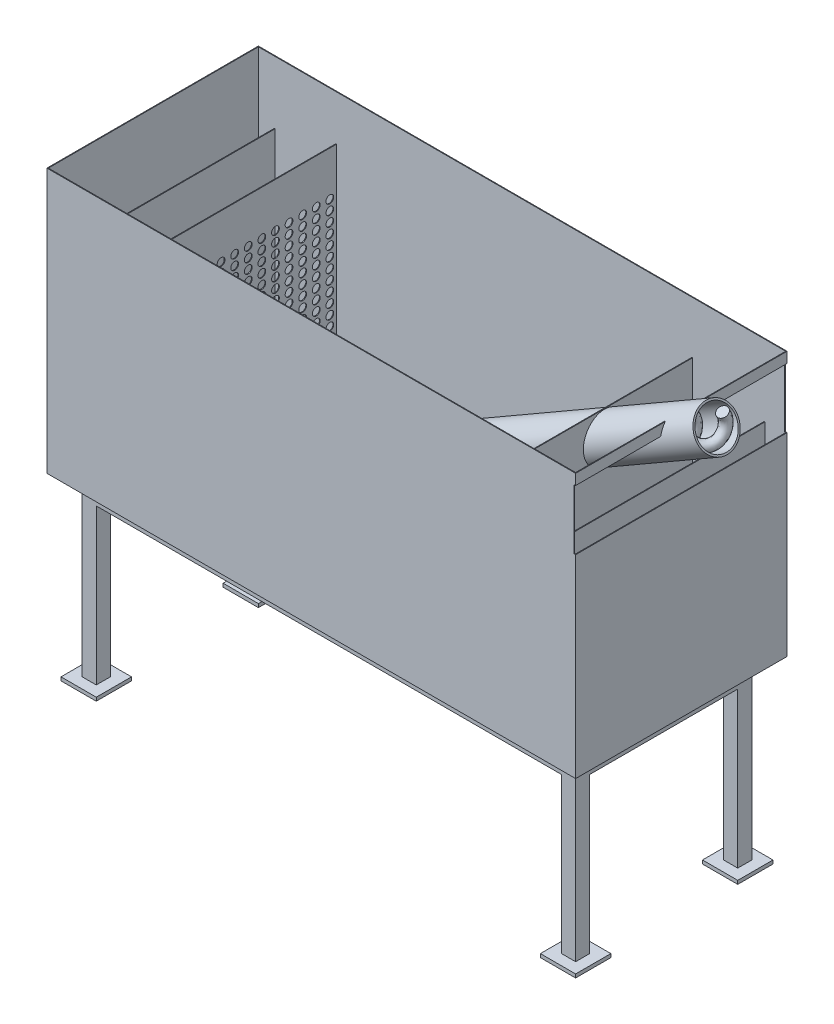
from build123d import *

# Parameters (mm, degrees)
MASTER_FOOTPRINT_W                       = 1500
MASTER_FOOTPRINT_H                       = 600
BATH_BASE_PLATE_DEPTH                    = 750
BATH_SHELL_2MM_T                         = -2
SKETCH_1_R                               = 50.00000000000001
INLET_D100_OPENING_DEPTH                 = 10
INLET_IMPACT_BAFFLE_START                = 125
SKETCH_2_W                               = 440
SKETCH_2_H                               = 430
INLET_IMPACT_BAFFLE_DEPTH                = 2
DISTRIBUTOR_D22_START                    = 250
SKETCH_3_W                               = 540
SKETCH_3_H                               = 648
SKETCH_3_R                               = 10.999999999999996
SKETCH_3_R_2                             = 11.00000000000001
SKETCH_3_R_3                             = 10.999999999999982
DISTRIBUTOR_D22_DEPTH                    = 2
OUTLET_SUBMERGED_BAFFLE_START            = 1280
SKETCH_4_W                               = 499.9999999999999
SKETCH_4_H                               = 330
OUTLET_SUBMERGED_BAFFLE_DEPTH            = 2
OVERFLOW_WEIR_Z550_START                 = 1440
SKETCH_5_W                               = 590
SKETCH_5_H                               = 548
OVERFLOW_WEIR_Z550_DEPTH                 = 2
OUTLET_WEIR_SLOT_W600_START              = 1495
SKETCH_6_W                               = 600
SKETCH_6_H                               = 170
OUTLET_WEIR_SLOT_W600_DEPTH              = 10
SLOPED_SEDIMENT_FLOOR_START              = 275
SLOPED_SEDIMENT_FLOOR_DEPTH              = 975
SKETCH_8_W                               = 39.99999999999999
SKETCH_8_H                               = 39.99999999999999
SKETCH_8_H_2                             = 39.99999999999994
SKETCH_8_W_2                             = 40
FRAME_LEGS_40X40_H500_DEPTH              = 500
FRAME_LONGITUDINAL_RAILS_START           = -20
SKETCH_9_W                               = 1400
SKETCH_9_H                               = 39.99999999999999
SKETCH_9_H_2                             = 39.99999999999983
FRAME_LONGITUDINAL_RAILS_DEPTH           = 40
FRAME_TRANSVERSE_RAILS_START             = -20
SKETCH_10_W                              = 39.99999999999999
SKETCH_10_H                              = 420.00000000000006
SKETCH_10_W_2                            = 40
FRAME_TRANSVERSE_RAILS_DEPTH             = 40
FRAME_FOOT_PADS_100X100_START            = -500
SKETCH_11_W                              = 100.00000000000001
SKETCH_11_H                              = 100.00000000000001
SKETCH_11_H_2                            = 99.99999999999994
SKETCH_11_W_2                            = 100
FRAME_FOOT_PADS_100X100_DEPTH            = 10
SCREW_PASSAGE_D120_PROFILE_R             = 60
SCREW_CASING_ID110_T5_PROFILE_R          = 60
SCREW_CASING_ID110_T5_PROFILE_R_2        = 55
SHAFTLESS_ROUND_COIL_D100_P100_PROFILE_R = 15


with BuildPart() as part:
    # MASTER_FOOTPRINT → BATH_BASE_PLATE (new body)
    with BuildSketch(Plane(origin=(0, 0, 0), x_dir=(1, 0, 0), z_dir=(0, 1, 0))):
        with Locations((750, 300)):
            Rectangle(MASTER_FOOTPRINT_W, MASTER_FOOTPRINT_H)
    extrude(amount=BATH_BASE_PLATE_DEPTH)

    # BATH_SHELL_2MM
    bath_shell_2mm_openings = [part.faces().sort_by_distance(p)[0] for p in [
        (750, 750, -300),
    ]]
    offset(amount=BATH_SHELL_2MM_T, openings=bath_shell_2mm_openings, kind=Kind.INTERSECTION)

    # Эскиз1 → INLET_D100_OPENING (cut)
    with BuildSketch(Plane(origin=(0, 0, 0), x_dir=(0, 0, -1), z_dir=(1, 0, 0))):
        with Locations((300, 420)):
            Circle(SKETCH_1_R)
    extrude(amount=INLET_D100_OPENING_DEPTH, mode=Mode.SUBTRACT)

    # Эскиз6 → OUTLET_WEIR_SLOT_W600 (cut)
    with BuildSketch(Plane(origin=(0, 0, 0), x_dir=(0, 0, -1), z_dir=(1, 0, 0)).offset(OUTLET_WEIR_SLOT_W600_START)):
        with Locations((300, 635)):
            Rectangle(SKETCH_6_W, SKETCH_6_H)
    extrude(amount=OUTLET_WEIR_SLOT_W600_DEPTH, mode=Mode.SUBTRACT)

    # Эскиз7 → SLOPED_SEDIMENT_FLOOR (add)
    with BuildSketch(Plane(origin=(0, 0, 0), x_dir=(0, 0, -1), z_dir=(1, 0, 0)).offset(SLOPED_SEDIMENT_FLOOR_START)):
        Polygon((2, -1), (2, 120), (229.99999999999997, -1), align=None)
        Polygon((598, -1), (598, 120), (370, -1), align=None)
    extrude(amount=SLOPED_SEDIMENT_FLOOR_DEPTH)

    # Эскиз8 → FRAME_LEGS_40X40_H500 (add)
    with BuildSketch(Plane(origin=(0, 0, 0), x_dir=(1, 0, 0), z_dir=(0, 1, 0))):
        with Locations((70, 70)):
            Rectangle(SKETCH_8_W, SKETCH_8_H)
        with Locations((70, 530)):
            Rectangle(SKETCH_8_W, SKETCH_8_H_2)
        with Locations((1430, 70)):
            Rectangle(SKETCH_8_W_2, SKETCH_8_H)
        with Locations((1430, 530)):
            Rectangle(SKETCH_8_W_2, SKETCH_8_H_2)
    extrude(amount=-FRAME_LEGS_40X40_H500_DEPTH)

    # Эскиз9 → FRAME_LONGITUDINAL_RAILS (add)
    with BuildSketch(Plane(origin=(0, 0, 0), x_dir=(1, 0, 0), z_dir=(0, 1, 0)).offset(FRAME_LONGITUDINAL_RAILS_START)):
        with Locations((750, 70)):
            Rectangle(SKETCH_9_W, SKETCH_9_H)
        with Locations((750, 530)):
            Rectangle(SKETCH_9_W, SKETCH_9_H_2)
    extrude(amount=-FRAME_LONGITUDINAL_RAILS_DEPTH)

    # Эскиз10 → FRAME_TRANSVERSE_RAILS (add)
    with BuildSketch(Plane(origin=(0, 0, 0), x_dir=(1, 0, 0), z_dir=(0, 1, 0)).offset(FRAME_TRANSVERSE_RAILS_START)):
        with Locations((70, 300)):
            Rectangle(SKETCH_10_W, SKETCH_10_H)
        with Locations((1430, 300)):
            Rectangle(SKETCH_10_W_2, SKETCH_10_H)
    extrude(amount=-FRAME_TRANSVERSE_RAILS_DEPTH)

    # Эскиз11 → FRAME_FOOT_PADS_100X100 (add)
    with BuildSketch(Plane(origin=(0, 0, 0), x_dir=(1, 0, 0), z_dir=(0, 1, 0)).offset(FRAME_FOOT_PADS_100X100_START)):
        with Locations((70, 70)):
            Rectangle(SKETCH_11_W, SKETCH_11_H)
        with Locations((70, 530)):
            Rectangle(SKETCH_11_W, SKETCH_11_H_2)
        with Locations((1430, 70)):
            Rectangle(SKETCH_11_W_2, SKETCH_11_H)
        with Locations((1430, 530)):
            Rectangle(SKETCH_11_W_2, SKETCH_11_H_2)
    extrude(amount=-FRAME_FOOT_PADS_100X100_DEPTH)


with BuildPart() as body_2:
    # Эскиз2 → INLET_IMPACT_BAFFLE (new body)
    with BuildSketch(Plane(origin=(0, 0, 0), x_dir=(0, 0, -1), z_dir=(1, 0, 0)).offset(INLET_IMPACT_BAFFLE_START)):
        with Locations((300, 435)):
            Rectangle(SKETCH_2_W, SKETCH_2_H)
    extrude(amount=INLET_IMPACT_BAFFLE_DEPTH)


with BuildPart() as body_3:
    # Эскиз3 → DISTRIBUTOR_D22 (new body)
    with BuildSketch(Plane(origin=(0, 0, 0), x_dir=(0, 0, -1), z_dir=(1, 0, 0)).offset(DISTRIBUTOR_D22_START)):
        with Locations((300, 326)):
            Rectangle(SKETCH_3_W, SKETCH_3_H)
        with Locations((49.28571428571428, 125)):
            Circle(SKETCH_3_R, mode=Mode.SUBTRACT)
        with Locations((49.28571428571428, 153.5)):
            Circle(SKETCH_3_R, mode=Mode.SUBTRACT)
        with Locations((49.28571428571428, 182)):
            Circle(SKETCH_3_R, mode=Mode.SUBTRACT)
        with Locations((49.28571428571428, 210.50000000000003)):
            Circle(SKETCH_3_R, mode=Mode.SUBTRACT)
        with Locations((49.28571428571428, 239)):
            Circle(SKETCH_3_R, mode=Mode.SUBTRACT)
        with Locations((49.28571428571428, 267.5)):
            Circle(SKETCH_3_R, mode=Mode.SUBTRACT)
        with Locations((49.28571428571428, 296.00000000000006)):
            Circle(SKETCH_3_R, mode=Mode.SUBTRACT)
        with Locations((49.28571428571428, 324.5)):
            Circle(SKETCH_3_R, mode=Mode.SUBTRACT)
        with Locations((49.28571428571428, 353)):
            Circle(SKETCH_3_R, mode=Mode.SUBTRACT)
        with Locations((49.28571428571428, 381.5)):
            Circle(SKETCH_3_R, mode=Mode.SUBTRACT)
        with Locations((49.28571428571428, 410.00000000000006)):
            Circle(SKETCH_3_R, mode=Mode.SUBTRACT)
        with Locations((49.28571428571428, 438.5)):
            Circle(SKETCH_3_R, mode=Mode.SUBTRACT)
        with Locations((49.28571428571428, 467)):
            Circle(SKETCH_3_R, mode=Mode.SUBTRACT)
        with Locations((49.28571428571428, 495.5)):
            Circle(SKETCH_3_R, mode=Mode.SUBTRACT)
        with Locations((49.28571428571428, 524)):
            Circle(SKETCH_3_R, mode=Mode.SUBTRACT)
        with Locations((87.85714285714285, 125)):
            Circle(SKETCH_3_R, mode=Mode.SUBTRACT)
        with Locations((87.85714285714285, 153.5)):
            Circle(SKETCH_3_R, mode=Mode.SUBTRACT)
        with Locations((87.85714285714285, 182)):
            Circle(SKETCH_3_R, mode=Mode.SUBTRACT)
        with Locations((87.85714285714285, 210.50000000000003)):
            Circle(SKETCH_3_R, mode=Mode.SUBTRACT)
        with Locations((87.85714285714285, 239)):
            Circle(SKETCH_3_R, mode=Mode.SUBTRACT)
        with Locations((87.85714285714285, 267.5)):
            Circle(SKETCH_3_R, mode=Mode.SUBTRACT)
        with Locations((87.85714285714285, 296.00000000000006)):
            Circle(SKETCH_3_R, mode=Mode.SUBTRACT)
        with Locations((87.85714285714285, 324.5)):
            Circle(SKETCH_3_R, mode=Mode.SUBTRACT)
        with Locations((87.85714285714285, 353)):
            Circle(SKETCH_3_R, mode=Mode.SUBTRACT)
        with Locations((87.85714285714285, 381.5)):
            Circle(SKETCH_3_R, mode=Mode.SUBTRACT)
        with Locations((87.85714285714285, 410.00000000000006)):
            Circle(SKETCH_3_R, mode=Mode.SUBTRACT)
        with Locations((87.85714285714285, 438.5)):
            Circle(SKETCH_3_R, mode=Mode.SUBTRACT)
        with Locations((87.85714285714285, 467)):
            Circle(SKETCH_3_R, mode=Mode.SUBTRACT)
        with Locations((87.85714285714285, 495.5)):
            Circle(SKETCH_3_R, mode=Mode.SUBTRACT)
        with Locations((87.85714285714285, 524)):
            Circle(SKETCH_3_R, mode=Mode.SUBTRACT)
        with Locations((126.42857142857142, 125)):
            Circle(SKETCH_3_R_2, mode=Mode.SUBTRACT)
        with Locations((126.42857142857142, 153.5)):
            Circle(SKETCH_3_R_2, mode=Mode.SUBTRACT)
        with Locations((126.42857142857142, 182)):
            Circle(SKETCH_3_R_2, mode=Mode.SUBTRACT)
        with Locations((126.42857142857142, 210.50000000000003)):
            Circle(SKETCH_3_R_2, mode=Mode.SUBTRACT)
        with Locations((126.42857142857142, 239)):
            Circle(SKETCH_3_R_2, mode=Mode.SUBTRACT)
        with Locations((126.42857142857142, 267.5)):
            Circle(SKETCH_3_R_2, mode=Mode.SUBTRACT)
        with Locations((126.42857142857142, 296.00000000000006)):
            Circle(SKETCH_3_R_2, mode=Mode.SUBTRACT)
        with Locations((126.42857142857142, 324.5)):
            Circle(SKETCH_3_R_2, mode=Mode.SUBTRACT)
        with Locations((126.42857142857142, 353)):
            Circle(SKETCH_3_R_2, mode=Mode.SUBTRACT)
        with Locations((126.42857142857142, 381.5)):
            Circle(SKETCH_3_R_2, mode=Mode.SUBTRACT)
        with Locations((126.42857142857142, 410.00000000000006)):
            Circle(SKETCH_3_R_2, mode=Mode.SUBTRACT)
        with Locations((126.42857142857142, 438.5)):
            Circle(SKETCH_3_R_2, mode=Mode.SUBTRACT)
        with Locations((126.42857142857142, 467)):
            Circle(SKETCH_3_R_2, mode=Mode.SUBTRACT)
        with Locations((126.42857142857142, 495.5)):
            Circle(SKETCH_3_R_2, mode=Mode.SUBTRACT)
        with Locations((126.42857142857142, 524)):
            Circle(SKETCH_3_R_2, mode=Mode.SUBTRACT)
        with Locations((164.99999999999997, 125)):
            Circle(SKETCH_3_R_2, mode=Mode.SUBTRACT)
        with Locations((164.99999999999997, 153.5)):
            Circle(SKETCH_3_R_2, mode=Mode.SUBTRACT)
        with Locations((164.99999999999997, 182)):
            Circle(SKETCH_3_R_2, mode=Mode.SUBTRACT)
        with Locations((164.99999999999997, 210.50000000000003)):
            Circle(SKETCH_3_R_2, mode=Mode.SUBTRACT)
        with Locations((164.99999999999997, 239)):
            Circle(SKETCH_3_R_2, mode=Mode.SUBTRACT)
        with Locations((164.99999999999997, 267.5)):
            Circle(SKETCH_3_R_2, mode=Mode.SUBTRACT)
        with Locations((164.99999999999997, 296.00000000000006)):
            Circle(SKETCH_3_R_2, mode=Mode.SUBTRACT)
        with Locations((164.99999999999997, 324.5)):
            Circle(SKETCH_3_R_2, mode=Mode.SUBTRACT)
        with Locations((164.99999999999997, 353)):
            Circle(SKETCH_3_R_2, mode=Mode.SUBTRACT)
        with Locations((164.99999999999997, 381.5)):
            Circle(SKETCH_3_R_2, mode=Mode.SUBTRACT)
        with Locations((164.99999999999997, 410.00000000000006)):
            Circle(SKETCH_3_R_2, mode=Mode.SUBTRACT)
        with Locations((164.99999999999997, 438.5)):
            Circle(SKETCH_3_R_2, mode=Mode.SUBTRACT)
        with Locations((164.99999999999997, 467)):
            Circle(SKETCH_3_R_2, mode=Mode.SUBTRACT)
        with Locations((164.99999999999997, 495.5)):
            Circle(SKETCH_3_R_2, mode=Mode.SUBTRACT)
        with Locations((164.99999999999997, 524)):
            Circle(SKETCH_3_R_2, mode=Mode.SUBTRACT)
        with Locations((203.57142857142856, 125)):
            Circle(SKETCH_3_R_2, mode=Mode.SUBTRACT)
        with Locations((203.57142857142856, 153.5)):
            Circle(SKETCH_3_R_2, mode=Mode.SUBTRACT)
        with Locations((203.57142857142856, 182)):
            Circle(SKETCH_3_R_2, mode=Mode.SUBTRACT)
        with Locations((203.57142857142856, 210.50000000000003)):
            Circle(SKETCH_3_R_2, mode=Mode.SUBTRACT)
        with Locations((203.57142857142856, 239)):
            Circle(SKETCH_3_R_2, mode=Mode.SUBTRACT)
        with Locations((203.57142857142856, 267.5)):
            Circle(SKETCH_3_R_2, mode=Mode.SUBTRACT)
        with Locations((203.57142857142856, 296.00000000000006)):
            Circle(SKETCH_3_R_2, mode=Mode.SUBTRACT)
        with Locations((203.57142857142856, 324.5)):
            Circle(SKETCH_3_R_2, mode=Mode.SUBTRACT)
        with Locations((203.57142857142856, 353)):
            Circle(SKETCH_3_R_2, mode=Mode.SUBTRACT)
        with Locations((203.57142857142856, 381.5)):
            Circle(SKETCH_3_R_2, mode=Mode.SUBTRACT)
        with Locations((203.57142857142856, 410.00000000000006)):
            Circle(SKETCH_3_R_2, mode=Mode.SUBTRACT)
        with Locations((203.57142857142856, 438.5)):
            Circle(SKETCH_3_R_2, mode=Mode.SUBTRACT)
        with Locations((203.57142857142856, 467)):
            Circle(SKETCH_3_R_2, mode=Mode.SUBTRACT)
        with Locations((203.57142857142856, 495.5)):
            Circle(SKETCH_3_R_2, mode=Mode.SUBTRACT)
        with Locations((203.57142857142856, 524)):
            Circle(SKETCH_3_R_2, mode=Mode.SUBTRACT)
        with Locations((242.14285714285714, 125)):
            Circle(SKETCH_3_R_3, mode=Mode.SUBTRACT)
        with Locations((242.14285714285714, 153.5)):
            Circle(SKETCH_3_R_3, mode=Mode.SUBTRACT)
        with Locations((242.14285714285714, 182)):
            Circle(SKETCH_3_R_3, mode=Mode.SUBTRACT)
        with Locations((242.14285714285714, 210.50000000000003)):
            Circle(SKETCH_3_R_3, mode=Mode.SUBTRACT)
        with Locations((242.14285714285714, 239)):
            Circle(SKETCH_3_R_3, mode=Mode.SUBTRACT)
        with Locations((242.14285714285714, 267.5)):
            Circle(SKETCH_3_R_3, mode=Mode.SUBTRACT)
        with Locations((242.14285714285714, 296.00000000000006)):
            Circle(SKETCH_3_R_3, mode=Mode.SUBTRACT)
        with Locations((242.14285714285714, 324.5)):
            Circle(SKETCH_3_R_3, mode=Mode.SUBTRACT)
        with Locations((242.14285714285714, 353)):
            Circle(SKETCH_3_R_3, mode=Mode.SUBTRACT)
        with Locations((242.14285714285714, 381.5)):
            Circle(SKETCH_3_R_3, mode=Mode.SUBTRACT)
        with Locations((242.14285714285714, 410.00000000000006)):
            Circle(SKETCH_3_R_3, mode=Mode.SUBTRACT)
        with Locations((242.14285714285714, 438.5)):
            Circle(SKETCH_3_R_3, mode=Mode.SUBTRACT)
        with Locations((242.14285714285714, 467)):
            Circle(SKETCH_3_R_3, mode=Mode.SUBTRACT)
        with Locations((242.14285714285714, 495.5)):
            Circle(SKETCH_3_R_3, mode=Mode.SUBTRACT)
        with Locations((242.14285714285714, 524)):
            Circle(SKETCH_3_R_3, mode=Mode.SUBTRACT)
        with Locations((280.71428571428567, 125)):
            Circle(SKETCH_3_R_2, mode=Mode.SUBTRACT)
        with Locations((280.71428571428567, 153.5)):
            Circle(SKETCH_3_R_2, mode=Mode.SUBTRACT)
        with Locations((280.71428571428567, 182)):
            Circle(SKETCH_3_R_2, mode=Mode.SUBTRACT)
        with Locations((280.71428571428567, 210.50000000000003)):
            Circle(SKETCH_3_R_2, mode=Mode.SUBTRACT)
        with Locations((280.71428571428567, 239)):
            Circle(SKETCH_3_R_2, mode=Mode.SUBTRACT)
        with Locations((280.71428571428567, 267.5)):
            Circle(SKETCH_3_R_2, mode=Mode.SUBTRACT)
        with Locations((280.71428571428567, 296.00000000000006)):
            Circle(SKETCH_3_R_2, mode=Mode.SUBTRACT)
        with Locations((280.71428571428567, 324.5)):
            Circle(SKETCH_3_R_2, mode=Mode.SUBTRACT)
        with Locations((280.71428571428567, 353)):
            Circle(SKETCH_3_R_2, mode=Mode.SUBTRACT)
        with Locations((280.71428571428567, 381.5)):
            Circle(SKETCH_3_R_2, mode=Mode.SUBTRACT)
        with Locations((280.71428571428567, 410.00000000000006)):
            Circle(SKETCH_3_R_2, mode=Mode.SUBTRACT)
        with Locations((280.71428571428567, 438.5)):
            Circle(SKETCH_3_R_2, mode=Mode.SUBTRACT)
        with Locations((280.71428571428567, 467)):
            Circle(SKETCH_3_R_2, mode=Mode.SUBTRACT)
        with Locations((280.71428571428567, 495.5)):
            Circle(SKETCH_3_R_2, mode=Mode.SUBTRACT)
        with Locations((280.71428571428567, 524)):
            Circle(SKETCH_3_R_2, mode=Mode.SUBTRACT)
        with Locations((319.2857142857143, 125)):
            Circle(SKETCH_3_R_2, mode=Mode.SUBTRACT)
        with Locations((319.2857142857143, 153.5)):
            Circle(SKETCH_3_R_2, mode=Mode.SUBTRACT)
        with Locations((319.2857142857143, 182)):
            Circle(SKETCH_3_R_2, mode=Mode.SUBTRACT)
        with Locations((319.2857142857143, 210.50000000000003)):
            Circle(SKETCH_3_R_2, mode=Mode.SUBTRACT)
        with Locations((319.2857142857143, 239)):
            Circle(SKETCH_3_R_2, mode=Mode.SUBTRACT)
        with Locations((319.2857142857143, 267.5)):
            Circle(SKETCH_3_R_2, mode=Mode.SUBTRACT)
        with Locations((319.2857142857143, 296.00000000000006)):
            Circle(SKETCH_3_R_2, mode=Mode.SUBTRACT)
        with Locations((319.2857142857143, 324.5)):
            Circle(SKETCH_3_R_2, mode=Mode.SUBTRACT)
        with Locations((319.2857142857143, 353)):
            Circle(SKETCH_3_R_2, mode=Mode.SUBTRACT)
        with Locations((319.2857142857143, 381.5)):
            Circle(SKETCH_3_R_2, mode=Mode.SUBTRACT)
        with Locations((319.2857142857143, 410.00000000000006)):
            Circle(SKETCH_3_R_2, mode=Mode.SUBTRACT)
        with Locations((319.2857142857143, 438.5)):
            Circle(SKETCH_3_R_2, mode=Mode.SUBTRACT)
        with Locations((319.2857142857143, 467)):
            Circle(SKETCH_3_R_2, mode=Mode.SUBTRACT)
        with Locations((319.2857142857143, 495.5)):
            Circle(SKETCH_3_R_2, mode=Mode.SUBTRACT)
        with Locations((319.2857142857143, 524)):
            Circle(SKETCH_3_R_2, mode=Mode.SUBTRACT)
        with Locations((357.8571428571428, 125)):
            Circle(SKETCH_3_R_2, mode=Mode.SUBTRACT)
        with Locations((357.8571428571428, 153.5)):
            Circle(SKETCH_3_R_2, mode=Mode.SUBTRACT)
        with Locations((357.8571428571428, 182)):
            Circle(SKETCH_3_R_2, mode=Mode.SUBTRACT)
        with Locations((357.8571428571428, 210.50000000000003)):
            Circle(SKETCH_3_R_2, mode=Mode.SUBTRACT)
        with Locations((357.8571428571428, 239)):
            Circle(SKETCH_3_R_2, mode=Mode.SUBTRACT)
        with Locations((357.8571428571428, 267.5)):
            Circle(SKETCH_3_R_2, mode=Mode.SUBTRACT)
        with Locations((357.8571428571428, 296.00000000000006)):
            Circle(SKETCH_3_R_2, mode=Mode.SUBTRACT)
        with Locations((357.8571428571428, 324.5)):
            Circle(SKETCH_3_R_2, mode=Mode.SUBTRACT)
        with Locations((357.8571428571428, 353)):
            Circle(SKETCH_3_R_2, mode=Mode.SUBTRACT)
        with Locations((357.8571428571428, 381.5)):
            Circle(SKETCH_3_R_2, mode=Mode.SUBTRACT)
        with Locations((357.8571428571428, 410.00000000000006)):
            Circle(SKETCH_3_R_2, mode=Mode.SUBTRACT)
        with Locations((357.8571428571428, 438.5)):
            Circle(SKETCH_3_R_2, mode=Mode.SUBTRACT)
        with Locations((357.8571428571428, 467)):
            Circle(SKETCH_3_R_2, mode=Mode.SUBTRACT)
        with Locations((357.8571428571428, 495.5)):
            Circle(SKETCH_3_R_2, mode=Mode.SUBTRACT)
        with Locations((357.8571428571428, 524)):
            Circle(SKETCH_3_R_2, mode=Mode.SUBTRACT)
        with Locations((396.42857142857133, 125)):
            Circle(SKETCH_3_R_2, mode=Mode.SUBTRACT)
        with Locations((396.42857142857133, 153.5)):
            Circle(SKETCH_3_R_2, mode=Mode.SUBTRACT)
        with Locations((396.42857142857133, 182)):
            Circle(SKETCH_3_R_2, mode=Mode.SUBTRACT)
        with Locations((396.42857142857133, 210.50000000000003)):
            Circle(SKETCH_3_R_2, mode=Mode.SUBTRACT)
        with Locations((396.42857142857133, 239)):
            Circle(SKETCH_3_R_2, mode=Mode.SUBTRACT)
        with Locations((396.42857142857133, 267.5)):
            Circle(SKETCH_3_R_2, mode=Mode.SUBTRACT)
        with Locations((396.42857142857133, 296.00000000000006)):
            Circle(SKETCH_3_R_2, mode=Mode.SUBTRACT)
        with Locations((396.42857142857133, 324.5)):
            Circle(SKETCH_3_R_2, mode=Mode.SUBTRACT)
        with Locations((396.42857142857133, 353)):
            Circle(SKETCH_3_R_2, mode=Mode.SUBTRACT)
        with Locations((396.42857142857133, 381.5)):
            Circle(SKETCH_3_R_2, mode=Mode.SUBTRACT)
        with Locations((396.42857142857133, 410.00000000000006)):
            Circle(SKETCH_3_R_2, mode=Mode.SUBTRACT)
        with Locations((396.42857142857133, 438.5)):
            Circle(SKETCH_3_R_2, mode=Mode.SUBTRACT)
        with Locations((396.42857142857133, 467)):
            Circle(SKETCH_3_R_2, mode=Mode.SUBTRACT)
        with Locations((396.42857142857133, 495.5)):
            Circle(SKETCH_3_R_2, mode=Mode.SUBTRACT)
        with Locations((396.42857142857133, 524)):
            Circle(SKETCH_3_R_2, mode=Mode.SUBTRACT)
        with Locations((434.99999999999994, 125)):
            Circle(SKETCH_3_R_2, mode=Mode.SUBTRACT)
        with Locations((434.99999999999994, 153.5)):
            Circle(SKETCH_3_R_2, mode=Mode.SUBTRACT)
        with Locations((434.99999999999994, 182)):
            Circle(SKETCH_3_R_2, mode=Mode.SUBTRACT)
        with Locations((434.99999999999994, 210.50000000000003)):
            Circle(SKETCH_3_R_2, mode=Mode.SUBTRACT)
        with Locations((434.99999999999994, 239)):
            Circle(SKETCH_3_R_2, mode=Mode.SUBTRACT)
        with Locations((434.99999999999994, 267.5)):
            Circle(SKETCH_3_R_2, mode=Mode.SUBTRACT)
        with Locations((434.99999999999994, 296.00000000000006)):
            Circle(SKETCH_3_R_2, mode=Mode.SUBTRACT)
        with Locations((434.99999999999994, 324.5)):
            Circle(SKETCH_3_R_2, mode=Mode.SUBTRACT)
        with Locations((434.99999999999994, 353)):
            Circle(SKETCH_3_R_2, mode=Mode.SUBTRACT)
        with Locations((434.99999999999994, 381.5)):
            Circle(SKETCH_3_R_2, mode=Mode.SUBTRACT)
        with Locations((434.99999999999994, 410.00000000000006)):
            Circle(SKETCH_3_R_2, mode=Mode.SUBTRACT)
        with Locations((434.99999999999994, 438.5)):
            Circle(SKETCH_3_R_2, mode=Mode.SUBTRACT)
        with Locations((434.99999999999994, 467)):
            Circle(SKETCH_3_R_2, mode=Mode.SUBTRACT)
        with Locations((434.99999999999994, 495.5)):
            Circle(SKETCH_3_R_2, mode=Mode.SUBTRACT)
        with Locations((434.99999999999994, 524)):
            Circle(SKETCH_3_R_2, mode=Mode.SUBTRACT)
        with Locations((473.57142857142856, 125)):
            Circle(SKETCH_3_R_2, mode=Mode.SUBTRACT)
        with Locations((473.57142857142856, 153.5)):
            Circle(SKETCH_3_R_2, mode=Mode.SUBTRACT)
        with Locations((473.57142857142856, 182)):
            Circle(SKETCH_3_R_2, mode=Mode.SUBTRACT)
        with Locations((473.57142857142856, 210.50000000000003)):
            Circle(SKETCH_3_R_2, mode=Mode.SUBTRACT)
        with Locations((473.57142857142856, 239)):
            Circle(SKETCH_3_R_2, mode=Mode.SUBTRACT)
        with Locations((473.57142857142856, 267.5)):
            Circle(SKETCH_3_R_2, mode=Mode.SUBTRACT)
        with Locations((473.57142857142856, 296.00000000000006)):
            Circle(SKETCH_3_R_2, mode=Mode.SUBTRACT)
        with Locations((473.57142857142856, 324.5)):
            Circle(SKETCH_3_R_2, mode=Mode.SUBTRACT)
        with Locations((473.57142857142856, 353)):
            Circle(SKETCH_3_R_2, mode=Mode.SUBTRACT)
        with Locations((473.57142857142856, 381.5)):
            Circle(SKETCH_3_R_2, mode=Mode.SUBTRACT)
        with Locations((473.57142857142856, 410.00000000000006)):
            Circle(SKETCH_3_R_2, mode=Mode.SUBTRACT)
        with Locations((473.57142857142856, 438.5)):
            Circle(SKETCH_3_R_2, mode=Mode.SUBTRACT)
        with Locations((473.57142857142856, 467)):
            Circle(SKETCH_3_R_2, mode=Mode.SUBTRACT)
        with Locations((473.57142857142856, 495.5)):
            Circle(SKETCH_3_R_2, mode=Mode.SUBTRACT)
        with Locations((473.57142857142856, 524)):
            Circle(SKETCH_3_R_2, mode=Mode.SUBTRACT)
        with Locations((512.1428571428571, 125)):
            Circle(SKETCH_3_R_2, mode=Mode.SUBTRACT)
        with Locations((512.1428571428571, 153.5)):
            Circle(SKETCH_3_R_2, mode=Mode.SUBTRACT)
        with Locations((512.1428571428571, 182)):
            Circle(SKETCH_3_R_2, mode=Mode.SUBTRACT)
        with Locations((512.1428571428571, 210.50000000000003)):
            Circle(SKETCH_3_R_2, mode=Mode.SUBTRACT)
        with Locations((512.1428571428571, 239)):
            Circle(SKETCH_3_R_2, mode=Mode.SUBTRACT)
        with Locations((512.1428571428571, 267.5)):
            Circle(SKETCH_3_R_2, mode=Mode.SUBTRACT)
        with Locations((512.1428571428571, 296.00000000000006)):
            Circle(SKETCH_3_R_2, mode=Mode.SUBTRACT)
        with Locations((512.1428571428571, 324.5)):
            Circle(SKETCH_3_R_2, mode=Mode.SUBTRACT)
        with Locations((512.1428571428571, 353)):
            Circle(SKETCH_3_R_2, mode=Mode.SUBTRACT)
        with Locations((512.1428571428571, 381.5)):
            Circle(SKETCH_3_R_2, mode=Mode.SUBTRACT)
        with Locations((512.1428571428571, 410.00000000000006)):
            Circle(SKETCH_3_R_2, mode=Mode.SUBTRACT)
        with Locations((512.1428571428571, 438.5)):
            Circle(SKETCH_3_R_2, mode=Mode.SUBTRACT)
        with Locations((512.1428571428571, 467)):
            Circle(SKETCH_3_R_2, mode=Mode.SUBTRACT)
        with Locations((512.1428571428571, 495.5)):
            Circle(SKETCH_3_R_2, mode=Mode.SUBTRACT)
        with Locations((512.1428571428571, 524)):
            Circle(SKETCH_3_R_2, mode=Mode.SUBTRACT)
        with Locations((550.7142857142857, 125)):
            Circle(SKETCH_3_R_2, mode=Mode.SUBTRACT)
        with Locations((550.7142857142857, 153.5)):
            Circle(SKETCH_3_R_2, mode=Mode.SUBTRACT)
        with Locations((550.7142857142857, 182)):
            Circle(SKETCH_3_R_2, mode=Mode.SUBTRACT)
        with Locations((550.7142857142857, 210.50000000000003)):
            Circle(SKETCH_3_R_2, mode=Mode.SUBTRACT)
        with Locations((550.7142857142857, 239)):
            Circle(SKETCH_3_R_2, mode=Mode.SUBTRACT)
        with Locations((550.7142857142857, 267.5)):
            Circle(SKETCH_3_R_2, mode=Mode.SUBTRACT)
        with Locations((550.7142857142857, 296.00000000000006)):
            Circle(SKETCH_3_R_2, mode=Mode.SUBTRACT)
        with Locations((550.7142857142857, 324.5)):
            Circle(SKETCH_3_R_2, mode=Mode.SUBTRACT)
        with Locations((550.7142857142857, 353)):
            Circle(SKETCH_3_R_2, mode=Mode.SUBTRACT)
        with Locations((550.7142857142857, 381.5)):
            Circle(SKETCH_3_R_2, mode=Mode.SUBTRACT)
        with Locations((550.7142857142857, 410.00000000000006)):
            Circle(SKETCH_3_R_2, mode=Mode.SUBTRACT)
        with Locations((550.7142857142857, 438.5)):
            Circle(SKETCH_3_R_2, mode=Mode.SUBTRACT)
        with Locations((550.7142857142857, 467)):
            Circle(SKETCH_3_R_2, mode=Mode.SUBTRACT)
        with Locations((550.7142857142857, 495.5)):
            Circle(SKETCH_3_R_2, mode=Mode.SUBTRACT)
        with Locations((550.7142857142857, 524)):
            Circle(SKETCH_3_R_2, mode=Mode.SUBTRACT)
    extrude(amount=DISTRIBUTOR_D22_DEPTH)


with BuildPart() as body_4:
    # Эскиз4 → OUTLET_SUBMERGED_BAFFLE (new body)
    with BuildSketch(Plane(origin=(0, 0, 0), x_dir=(0, 0, -1), z_dir=(1, 0, 0)).offset(OUTLET_SUBMERGED_BAFFLE_START)):
        with Locations((299.99999999999994, 485)):
            Rectangle(SKETCH_4_W, SKETCH_4_H)
    extrude(amount=OUTLET_SUBMERGED_BAFFLE_DEPTH)


with BuildPart() as body_5:
    # Эскиз5 → OVERFLOW_WEIR_Z550 (new body)
    with BuildSketch(Plane(origin=(0, 0, 0), x_dir=(0, 0, -1), z_dir=(1, 0, 0)).offset(OVERFLOW_WEIR_Z550_START)):
        with Locations((300, 276)):
            Rectangle(SKETCH_5_W, SKETCH_5_H)
    extrude(amount=OVERFLOW_WEIR_Z550_DEPTH)


with BuildPart() as screw_passage_d120_tool:
    # SCREW_PASSAGE_D120: sweep along a curve in space
    with BuildLine() as screw_passage_d120_path:
        Line((400, 70, -300), (1600, 762.820323027551, -300))
    # SCREW_PASSAGE_D120 profile (on start of the path) → SCREW_PASSAGE_D120 (sweep)
    with BuildSketch(Plane(origin=(400, 70, -300), x_dir=(-0.5000000000000001, 0.8660254037844387, 0), z_dir=(0.8660254037844387, 0.5000000000000001, 0))):
        Circle(SCREW_PASSAGE_D120_PROFILE_R)
    sweep(path=screw_passage_d120_path.line)


with BuildPart() as part_1:
    add(part.part)

    # SCREW_PASSAGE_D120: cut by screw_passage_d120_tool
    add(screw_passage_d120_tool.part, mode=Mode.SUBTRACT)


with BuildPart() as body_4_1:
    add(body_4.part)

    # SCREW_PASSAGE_D120: cut by screw_passage_d120_tool
    add(screw_passage_d120_tool.part, mode=Mode.SUBTRACT)


with BuildPart() as body_6:
    # SCREW_CASING_ID110_T5: sweep along a curve in space
    with BuildLine() as screw_casing_id110_t5_path:
        Line((400, 70, -300), (1600, 762.820323027551, -300))
    # SCREW_CASING_ID110_T5 profile (on start of the path) → SCREW_CASING_ID110_T5 (sweep)
    with BuildSketch(Plane(origin=(400, 70, -300), x_dir=(-0.5000000000000001, 0.8660254037844387, 0), z_dir=(0.8660254037844387, 0.5000000000000001, 0))):
        Circle(SCREW_CASING_ID110_T5_PROFILE_R)
        Circle(SCREW_CASING_ID110_T5_PROFILE_R_2, mode=Mode.SUBTRACT)
    sweep(path=screw_casing_id110_t5_path.line)


with BuildPart() as body_7:
    # SHAFTLESS_ROUND_COIL_D100_P100: sweep along a curve in space
    with BuildLine() as shaftless_round_coil_d100_p100_path:
        add(Edge.make_bspline(
            [(382.5, 100.31088913245537, -300), (384.564126832484, 100.89679960651334, -295.4252626190951), (388.6923804974521, 102.06862055462925, -286.2757878572854), (398.13442746402075, 98.19776454464007, -274.63543839458805), (409.3104600517273, 91.32355733924642, -266.8464038762299), (421.58617012040133, 82.54465286487766, -264.09135899256023), (433.85356596039986, 73.78014905700061, -266.78862540424325), (445.0881010529496, 66.80461254084834, -274.5286544424799), (454.4000360154246, 63.1591171326243, -286.13621233156675), (461.197456487716, 63.86888857776613, -299.8488258278908), (465.26866699277394, 69.30059419825714, -313.5843933715703), (466.8163390998659, 79.10319653887622, -325.25732809645314), (466.426200947709, 92.26218470394231, -333.09523004350996), (464.9782451375268, 107.25336679785208, -335.9080045692546), (463.5130734819898, 122.2743676106112, -333.2685644354147), (463.0739040042549, 135.5182805227412, -325.57767806015863), (464.54816759331237, 145.44803014630403, -314.003117474915), (468.5327626423438, 151.02975813735404, -300.302345664835), (475.2434227413281, 151.88980295714714, -286.55566616687736), (484.4819600829853, 148.37143595733454, -274.85035306876887), (495.6663579719135, 141.48273962520364, -266.96372261055393), (507.91914332354327, 132.7435419255055, -264.09326829583546), (520.2006207893836, 123.95464802621649, -266.6748353708781), (531.4667384557318, 116.92440888761196, -274.3164427712902), (540.8276150360007, 113.19414411076411, -285.85780090729605), (547.6826580387994, 113.80411040540636, -299.5464882011584), (551.8117567825574, 119.13555065530883, -313.30403600976126), (553.4087036535182, 128.85280660137536, -325.04152001826714), (553.0517689761136, 141.95428466118315, -332.9767392064443), (551.61589736088, 156.92453631547306, -335.9048224347294), (550.1398574976865, 171.9643614160809, -333.38117417370665), (549.6685171596843, 185.26399589271685, -325.7889811865904), (551.0941921320922, 195.27790346898624, -314.281030056743), (555.0211583937147, 200.95944744780704, -300.604669894888), (561.673899807404, 201.91981037323922, -286.83649761190105), (570.8630228451327, 198.48703145845056, -275.0670507260172), (582.0140138019443, 191.65619763007103, -267.08338345025123), (594.2544720488692, 182.9383511020314, -264.097723205211), (606.5465739655579, 174.13105511407133, -266.56340792353376), (617.8446544384698, 167.04545477054538, -274.1060519347144), (627.253978998992, 163.2312756303746, -285.58039209358253), (634.1665988909854, 163.7415158275906, -299.2441827261242), (638.3536610490263, 168.97256049897464, -313.0227354589283), (640.000156786148, 178.6039952913932, -324.82393662266566), (639.6768330052581, 191.64725757074916, -332.8559104849623), (638.2535308914903, 206.5957382098747, -335.89909482946143), (636.7671106014776, 221.65354273713788, -333.4914173551837), (636.2640160559722, 235.00817711452288, -325.99845600438135), (637.6413845488722, 245.10575396763522, -314.55793018559893), (641.510826838479, 250.88693238864008, -300.9069512568962), (648.1055611366372, 251.94776658537253, -287.11826228282376), (657.2450016240585, 248.6010403719662, -275.2855160035632), (668.3621783156997, 241.82877456888252, -267.20537791197194), (680.5898248871695, 233.1331185136615, -264.1047234048566), (692.8920630226701, 224.3082660797222, -266.45435096185395), (704.2216885412174, 217.16802811442864, -273.89749684840154), (713.6791772243276, 213.2704262668336, -285.3040055573114), (720.6492671516132, 213.6811254430106, -298.9419308347211), (724.8943790983257, 218.81162493104637, -312.7405116618611), (726.5906901893372, 228.356776999531, -324.60459333521385), (726.3013834429559, 241.34112004679574, -332.7327524452105), (724.8911349515606, 256.2669911487486, -335.8908221595088), (723.3948228303958, 271.3419288301475, -333.59928616416056), (722.860392960221, 284.75083758193153, -326.20608766282413), (724.1897405411053, 294.9315890944806, -314.8337982306609), (728.0017677507315, 300.8122133511328, -301.2091683206371), (734.538410615941, 301.9736648612168, -287.4009402039521), (743.6279038288086, 298.713449865037, -275.50573341332085), (754.7108613195153, 292.00045345656616, -267.3296973469242), (766.9252125530547, 283.32782560214406, -264.1142683984929), (779.2370979567269, 274.486263609578, -266.347672217427), (790.5978485235961, 267.29211547920306, -273.6907922978545), (800.1032140570355, 263.3115884943309, -285.0286608928936), (807.1306630913758, 263.6229387828122, -298.63975395508294), (811.4339070857119, 268.65275061081644, -312.457384626803), (813.1802964866847, 278.11116450209073, -324.3835057062438), (812.925410501169, 291.03588904270106, -332.6072738184727), (811.5286988276175, 305.9383136883758, -335.88000501136224), (810.0229841722486, 321.0295370367361, -333.70477295328305), (809.4576400817543, 334.4919907887895, -326.41186144188174), (810.7392557225559, 344.7554164467062, -315.1086146342763), (814.4939808146754, 350.7352908822605, -301.5112996604448), (820.9724520479086, 351.99749861448726, -287.6845113348483), (830.0117368029861, 348.8242472181694, -275.7276873429865), (841.0600725829635, 342.1712173717274, -267.4563329414875), (853.2606457586695, 333.5224538135015, -264.1263575094284), (865.5816887959296, 324.665030334284, -266.24337925323766), (876.9731422071981, 317.41770331747284, -273.48595293738316), (886.5260939244816, 313.3547546444449, -284.7543776208762), (893.6107870711676, 313.56695522190887, -298.3376735100261), (897.9722412508102, 318.49594405144467, -312.1733744260323), (899.768968367516, 327.86717046153177, -324.1606894097531), (899.5489044289652, 340.7315814475757, -332.4794835005502), (898.1662118090363, 355.6097243801021, -335.866644151903), (896.6515845830037, 370.7163847536779, -333.8078702440699), (896.0557495682019, 384.23165033580136, -326.6157627532315), (897.2899256248077, 394.5772437638356, -315.3823599133486), (900.9874656243259, 400.65616568521085, -301.8133238567323), (907.4076891506296, 402.01926140526336, -287.96895557174935), (916.396507824207, 398.93341982616283, -275.95136205714675), (927.409821838164, 392.34104945783844, -267.58527571783696), (939.5961352129292, 383.7169845993486, -264.1409898806059), (951.9258455999641, 374.8445488299541, -266.1414794631309), (963.347577475032, 367.54477797546673, -273.2829932890646), (972.9478213360536, 363.39991690668563, -284.4811751865597), (980.089639542058, 363.5131739790249, -298.0357109155295), (984.5093779178811, 368.3412116194976, -311.88850119443845), (986.3566985874025, 377.6248074255727, -323.9361602422928), (986.1718555132079, 390.428214085065, -332.3493905511316), (984.8036631888007, 405.2812417690236, -335.8507405283486), (983.2806139875005, 420.40248943166216, -333.9085707274435), (982.6547135060571, 433.96982992956356, -326.81777714129953), (983.8417456975797, 444.3970789271857, -315.6550146607195), (987.4822216835367, 450.57483861933343, -302.1152194975083), (993.844125557427, 452.0389469404455, -288.25425274899413), (1002.7822241035847, 449.0409551990032, -276.17674169839364), (1013.7601187790972, 442.5099329244342, -267.71651653458053), (1025.9316916207615, 433.9113994182065, -264.15816447466443), (1038.2695784592859, 425.0248016194053, -266.0419800712876), (1049.7211622709642, 417.6733256940053, -273.08192774171306), (1059.3684008828434, 413.44706732904916, -284.2090729586181), (1066.56722104526, 413.4615941167516, -297.7338875792175), (1071.0453134960828, 418.1885595344961, -311.60278512809674), (1072.9434799686742, 427.384087826303, -323.70993412184777), (1072.7942540792462, 440.12580371215705, -332.21700419315096), (1071.4410422642611, 454.95288439267284, -335.8322952681855), (1069.9100622801661, 470.087868574056, -334.0068672642477), (1069.254523921235, 483.70654338159477, -327.0178902842846), (1070.3947113090505, 494.21492995930737, -315.9265595465421), (1073.9782484060368, 500.49131070007934, -302.4169651798948), (1080.2817648165985, 502.0565490742017, -288.54038264045323), (1089.168892785218, 499.14684096274647, -276.4038102884464), (1100.1109730609141, 492.67785104830193, -267.8500460874069), (1112.267325682347, 484.10567973681765, -264.17788007401157), (1124.612897494408, 475.20577117339747, -265.94488813171245), (1136.0939045991545, 467.80333260947583, -272.8827705498627), (1145.787837237321, 463.49619781858127, -283.938090227726), (1153.0435322120927, 463.4122145416133, -297.43222489884187), (1157.580044479724, 468.0379938684761, -311.316246482835), (1159.5293054009296, 477.1450239792991, -323.48202708670846), (1159.4160904915987, 489.824367017994, -332.08233381213296), (1158.0783383378946, 504.62467077970376, -335.8113096790898), (1156.5399193257294, 519.7725397356634, -334.1027528857539), (1155.8551727796414, 533.4418046073549, -327.2160879951749), (1156.9488177461867, 544.0308050234153, -316.1969753196553), (1160.4755451154717, 550.4055830989288, -302.71853951164496), (1166.7206103911667, 552.0720618084014, -288.82732496095986), (1175.5565209456856, 549.2510648604001, -276.63255172928916), (1186.462394299255, 542.8447871746657, -267.98585490974364), (1198.6030480923614, 534.299807031461, -264.2001352809111), (1210.955812855179, 525.387439911874, -265.85021052773413), (1222.4658125234905, 517.9347847548167, -272.68553583275315), (1232.2061351530015, 513.5473001419506, -283.66824620519156), (1239.5185737639345, 513.3650340041455, -297.1307442607647), (1244.113567448514, 517.889520545555, -311.02890557279636), (1246.114167841538, 526.9076280827551, -323.252455294334), (1246.0373551546395, 539.5239206226885, -331.94538895552796), (1244.7155407180626, 554.2966194485773, -335.7877852488339), (1243.170174959941, 569.4565205214803, -334.19622079415547), (1242.45665198774, 583.1756276252601, -327.4123562227526), (1243.5040602150737, 593.844712422811, -316.4662428089445), (1246.9741110454518, 600.3176571433094, -303.0199211126615), (1253.160665658631, 602.085479293043, -289.1150593677523), (1261.9451155935442, 599.3536147527873, -276.8629498043072), (1272.8143920695627, 593.0107247183695, -268.12393337343116), (1284.9388695392183, 584.4937627892625, -264.22492851758096), (1297.298334720068, 575.5697902052107, -265.75795397151717), (1308.836894167014, 568.0676680605075, -272.49023757332975), (1318.623299464111, 563.6003659260323, -283.3995600215948), (1325.9923465121733, 563.3200510989824, -296.82946703844175), (1330.645879067803, 567.7431453415159, -310.7407827690021), (1332.698060316141, 576.6719122166136, -323.0212350202057), (1332.6580385132754, 589.2244810761468, -331.80617933203536), (1331.3526387197687, 603.9687489062503, -335.76172364518095), (1329.800818990294, 619.1398285854467, -334.28726436304936), (1329.0589533931275, 632.9080265556872, -327.60668105259083), (1330.06043384126, 643.6566606002933, -316.7343429247039), (1333.4739453396044, 650.2275343164998, -303.32108861650835), (1339.601933910731, 652.0967958266666, -289.4035654619127), (1348.334683668832, 649.454478619411, -277.0949881794395), (1359.16697590641, 643.1756471650508, -268.2642716894028), (1371.2748007043072, 634.6875285095102, -264.2522580263058), (1383.640473295441, 625.752804375465, -265.66812500358594), (1395.2071577113443, 618.2019683555632, -272.29688961725424), (1405.039335085242, 613.6553866585032, -283.1320507254309), (1412.4648513581494, 613.277264264958, -296.5284145909083), (1417.17697608882, 617.5988738833939, -310.4518984979056), (1419.2809759191457, 626.437888341714, -322.7883826566751), (1419.2781310536254, 638.9260648568948, -331.6647148109153), (1417.9896216654151, 653.6410776468629, -335.73312671576736), (1416.4318411967465, 668.8224816291957, -334.3758771379059), (1415.6620687851096, 682.6390156199751, -327.7990487080396), (1416.6179336700995, 693.4666581375608, -317.00125665998723), (1419.9750470516378, 700.1352162575263, -303.6220206719302), (1426.044418353212, 702.10600585676, -289.6928227898138), (1434.725232042574, 699.5536445593045, -277.32865040433654), (1445.520155302819, 693.339538072313, -268.40685990838017), (1457.6108522612412, 684.8810857049657, -264.2821218695614), (1469.9822388148345, 675.9364646976273, -265.58072999236083), (1481.5766113961042, 668.3376713685448, -272.10550567192104), (1491.454247011005, 663.7123536884432, -282.865737281758), (1498.93608929309, 663.2366717852151, -296.22760826126284), (1503.7068553489037, 667.4567116490806, -310.1622732399439), (1505.8629078142142, 676.2055682989379, -322.55391471179627), (1505.8976233036904, 688.6286883709151, -331.52100542129773), (1504.626478885579, 703.3136241504008, -335.7019964879349), (1503.0632313323906, 718.5044974008904, -334.46205283666126), (1502.2659898954848, 732.368609139069, -327.98944555069926), (1503.176554666363, 743.2747137558865, -317.26696509383737), (1506.4774151481765, 750.0407047562484, -303.92269593734994), (1512.4881220952584, 752.1131039980542, -289.9828108707427), (1521.1167675548757, 749.6511007250585, -277.5639198158541), (1531.873939565617, 743.5023813202556, -268.551688286093), (1543.9470354124048, 735.07441497253, -264.3145165697635), (1556.3236395329802, 726.1207568740865, -265.4957802107461), (1567.9452710020473, 718.4747497663807, -271.9160803577199), (1577.8680123860509, 713.7713066024796, -282.6007092848836), (1585.4061656328224, 713.1980912473907, -295.9268054668163), (1590.2351247622241, 717.3173377511517, -309.872912447421), (1592.445301037968, 725.9724492114417, -322.31417203916646), (1592.5110876306624, 738.3417525539959, -331.3887795081075), (1591.283420729997, 752.9513830642798, -335.6171383110405), (1589.6195132866026, 768.3166043588892, -334.7368546237161), (1589.3080715883448, 777.1782032462407, -329.88880343772087), (1589.1523507392155, 781.6090026899166, -327.46477784472336)],
            knots=[0, 0, 0, 0, 0.00450450450450451, 0.00900900900900902, 0.01351351351351353, 0.01801801801801804, 0.02252252252252253, 0.02702702702702705, 0.03153153153153156, 0.03603603603603606, 0.04054054054054058, 0.04504504504504508, 0.0495495495495496, 0.0540540540540541, 0.05855855855855861, 0.06306306306306311, 0.06756756756756763, 0.07207207207207213, 0.07657657657657665, 0.08108108108108114, 0.08558558558558564, 0.09009009009009016, 0.0945945945945947, 0.09909909909909921, 0.10360360360360373, 0.10810810810810821, 0.11261261261261271, 0.11711711711711723, 0.12162162162162174, 0.12612612612612625, 0.13063063063063077, 0.13513513513513525, 0.13963963963963977, 0.14414414414414428, 0.14864864864864877, 0.15315315315315328, 0.1576576576576578, 0.1621621621621623, 0.16666666666666685, 0.17117117117117137, 0.17567567567567588, 0.1801801801801804, 0.18468468468468488, 0.18918918918918942, 0.1936936936936939, 0.19819819819819848, 0.202702702702703, 0.20720720720720753, 0.21171171171171205, 0.2162162162162165, 0.22072072072072105, 0.2252252252252255, 0.22972972972973002, 0.2342342342342346, 0.23873873873873908, 0.2432432432432436, 0.24774774774774808, 0.2522522522522526, 0.2567567567567571, 0.2612612612612616, 0.2657657657657661, 0.2702702702702707, 0.27477477477477513, 0.2792792792792796, 0.28378378378378416, 0.2882882882882887, 0.2927927927927932, 0.2972972972972977, 0.3018018018018022, 0.30630630630630673, 0.3108108108108112, 0.3153153153153157, 0.31981981981982016, 0.32432432432432473, 0.3288288288288292, 0.3333333333333337, 0.3378378378378382, 0.34234234234234273, 0.3468468468468472, 0.3513513513513517, 0.3558558558558562, 0.36036036036036073, 0.3648648648648652, 0.3693693693693697, 0.3738738738738743, 0.3783783783783788, 0.3828828828828833, 0.3873873873873877, 0.3918918918918923, 0.39639639639639684, 0.40090090090090125, 0.4054054054054058, 0.40990990990991033, 0.41441441441441484, 0.41891891891891925, 0.4234234234234238, 0.4279279279279283, 0.43243243243243285, 0.43693693693693736, 0.4414414414414418, 0.4459459459459463, 0.45045045045045085, 0.4549549549549554, 0.4594594594594598, 0.4639639639639643, 0.46846846846846885, 0.47297297297297325, 0.47747747747747776, 0.4819819819819822, 0.48648648648648685, 0.49099099099099125, 0.49549549549549576, 0.5000000000000002, 0.5045045045045048, 0.5090090090090093, 0.5135135135135138, 0.5180180180180184, 0.5225225225225228, 0.5270270270270273, 0.5315315315315319, 0.5360360360360363, 0.5405405405405408, 0.5450450450450453, 0.5495495495495497, 0.5540540540540543, 0.5585585585585587, 0.5630630630630632, 0.5675675675675677, 0.5720720720720722, 0.5765765765765767, 0.5810810810810813, 0.5855855855855857, 0.5900900900900903, 0.5945945945945946, 0.5990990990990992, 0.6036036036036038, 0.6081081081081082, 0.6126126126126128, 0.6171171171171171, 0.6216216216216217, 0.6261261261261263, 0.6306306306306309, 0.6351351351351353, 0.6396396396396399, 0.6441441441441444, 0.6486486486486489, 0.6531531531531535, 0.6576576576576579, 0.6621621621621626, 0.6666666666666671, 0.6711711711711716, 0.675675675675676, 0.6801801801801806, 0.684684684684685, 0.6891891891891896, 0.693693693693694, 0.6981981981981986, 0.7027027027027032, 0.7072072072072078, 0.7117117117117121, 0.7162162162162166, 0.7207207207207211, 0.7252252252252257, 0.72972972972973, 0.7342342342342346, 0.7387387387387392, 0.7432432432432438, 0.7477477477477481, 0.7522522522522526, 0.7567567567567571, 0.7612612612612616, 0.7657657657657662, 0.7702702702702704, 0.774774774774775, 0.7792792792792795, 0.783783783783784, 0.7882882882882885, 0.7927927927927931, 0.7972972972972975, 0.801801801801802, 0.8063063063063066, 0.810810810810811, 0.8153153153153154, 0.81981981981982, 0.8243243243243245, 0.828828828828829, 0.8333333333333336, 0.8378378378378378, 0.8423423423423424, 0.846846846846847, 0.8513513513513513, 0.8558558558558559, 0.8603603603603603, 0.8648648648648649, 0.8693693693693696, 0.873873873873874, 0.8783783783783784, 0.882882882882883, 0.8873873873873873, 0.8918918918918919, 0.8963963963963963, 0.9009009009009009, 0.9054054054054056, 0.9099099099099102, 0.9144144144144144, 0.918918918918919, 0.9234234234234235, 0.9279279279279279, 0.9324324324324323, 0.936936936936937, 0.9414414414414415, 0.945945945945946, 0.9504504504504504, 0.9549549549549551, 0.9594594594594597, 0.963963963963964, 0.9684684684684686, 0.9729729729729732, 0.9774774774774777, 0.9819819819819822, 0.9864864864864867, 0.9909909909909911, 0.9954954954954957, 1, 1, 1, 1], degree=3))
    # SHAFTLESS_ROUND_COIL_D100_P100 profile (on start of the path) → SHAFTLESS_ROUND_COIL_D100_P100 (sweep)
    with BuildSketch(Plane(origin=(382.5, 100.31088913245537, -300), x_dir=(0.9115113261654293, 0, -0.41127497160919063), z_dir=(0.40850072571325174, 0.11595452861181108, 0.9053627474035805))):
        Circle(SHAFTLESS_ROUND_COIL_D100_P100_PROFILE_R)
    sweep(path=shaftless_round_coil_d100_p100_path.line, is_frenet=True)


solid = Compound([body_2.part, body_3.part, body_5.part, part_1.part, body_4_1.part, body_6.part, body_7.part])
